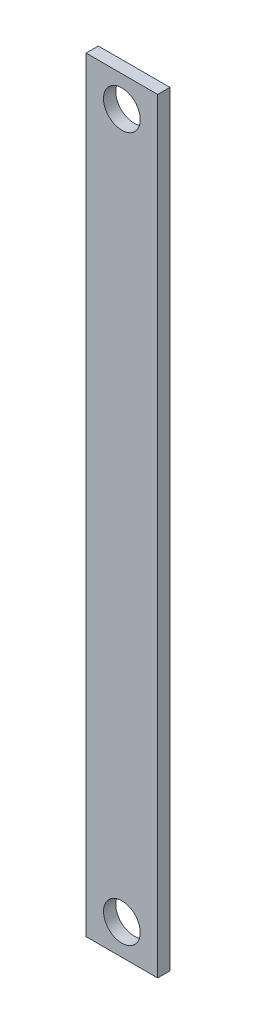
from build123d import *

# Parameters (mm, degrees)
SKETCH1_W           = 11.7
SKETCH1_H           = 125
BOSS_EXTRUDE1_DEPTH = 2
SKETCH2_R           = 3
CUT_EXTRUDE1_DEPTH  = 63.805035626


with BuildPart() as part:
    # Sketch1 → Boss-Extrude1 (new body)
    with BuildSketch(Plane.XY):
        Rectangle(SKETCH1_W, SKETCH1_H)
    extrude(amount=BOSS_EXTRUDE1_DEPTH)

    # Sketch2 → Cut-Extrude1 (cut, through all)
    with BuildSketch(Plane.XY.offset(2)):
        with Locations((0, 57.5)):
            Circle(SKETCH2_R)
        with Locations((0, -57.5)):
            Circle(SKETCH2_R)
    extrude(amount=-CUT_EXTRUDE1_DEPTH, mode=Mode.SUBTRACT)


solid = part.part
